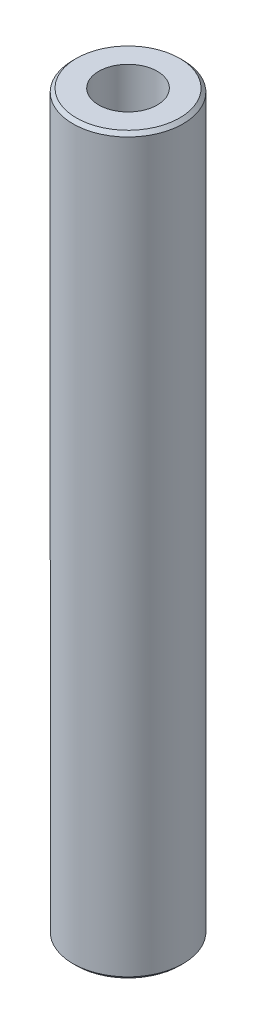
from build123d import *

# Parameters (mm, degrees)
SKETCH1_R           = 45
BOSS_EXTRUDE1_DEPTH = 600
SKETCH2_R           = 23.909911527
CUT_EXTRUDE1_DEPTH  = 604.365560834
CHAMFER1_SIZE       = 2.78629895


with BuildPart() as part:
    # Sketch1 → Boss-Extrude1 (new body)
    with BuildSketch(Plane(origin=(0, 0, 0), x_dir=(1, 0, 0), z_dir=(0, 1, 0))):
        Circle(SKETCH1_R)
    extrude(amount=BOSS_EXTRUDE1_DEPTH)

    # Sketch2 → Cut-Extrude1 (cut, through all)
    with BuildSketch(Plane(origin=(0, 0, 0), x_dir=(1, 0, 0), z_dir=(0, 1, 0))):
        Circle(SKETCH2_R)
    extrude(amount=CUT_EXTRUDE1_DEPTH, mode=Mode.SUBTRACT)

    # Chamfer1
    chamfer1_edges = [part.edges().sort_by_distance(p)[0] for p in [
        (-45, 600, 0),
        (-45, 0, 0),
    ]]
    chamfer(chamfer1_edges, length=CHAMFER1_SIZE)


solid = part.part
